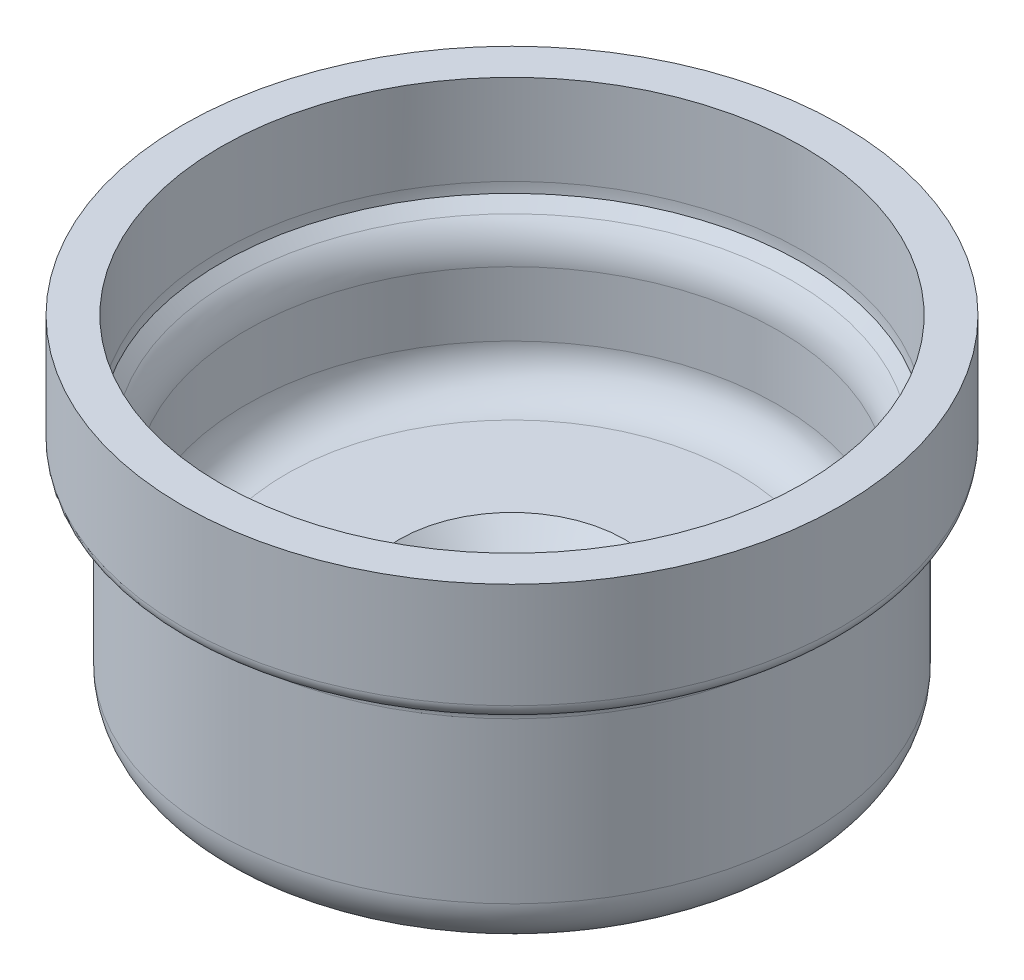
from build123d import *

# Parameters (mm, degrees)
SKETCH1_R           = 29.55
SKETCH1_R_2         = 26.55
BOSS_EXTRUDE1_DEPTH = 15
BOSS_EXTRUDE2_START = 10
SKETCH2_R           = 29.55
BOSS_EXTRUDE2_DEPTH = 10
CHAMFER1_SIZE       = 2.5
FILLET1_R           = 4
SKETCH4_R           = 32.9
SKETCH4_R_2         = 29.1
BOSS_EXTRUDE3_DEPTH = 10
BOSS_EXTRUDE4_START = 2
SKETCH5_R           = 32.9
SKETCH5_R_2         = 29.55
BOSS_EXTRUDE4_DEPTH = 2
FILLET3_R           = 2
FILLET6_R           = 5
FILLET7_R           = 5
FILLET8_R           = 1.5
SKETCH6_R           = 8.25
CUT_EXTRUDE1_DEPTH  = 7
CHAMFER4_SIZE       = 3
SKETCH7_R           = 4.1
CUT_EXTRUDE2_DEPTH  = 57.4696385
FILLET9_R           = 2
FILLET10_R          = 10


with BuildPart() as part:
    # Sketch1 → Boss-Extrude1 (new body)
    with BuildSketch(Plane(origin=(0, 0, 0), x_dir=(1, 0, 0), z_dir=(0, 1, 0))):
        with Locations(Location((0, 0, 0), (0, 0, 270))):
            Circle(SKETCH1_R)
        with Locations(Location((0, 0, 0), (0, 0, 270))):
            Circle(SKETCH1_R_2, mode=Mode.SUBTRACT)
    extrude(amount=BOSS_EXTRUDE1_DEPTH)

    # Sketch2 → Boss-Extrude2 (add)
    with BuildSketch(Plane.XZ.offset(BOSS_EXTRUDE2_START)):
        with Locations(Location((0, 0, 0), (0, 0, 270))):
            Circle(SKETCH2_R)
    extrude(amount=-BOSS_EXTRUDE2_DEPTH)

    # Chamfer1
    chamfer1_edges = [part.edges().sort_by_distance(p)[0] for p in [
        (0, 15, -26.55),
    ]]
    chamfer(chamfer1_edges, length=CHAMFER1_SIZE)

    # Fillet1
    fillet1_edges = [part.edges().sort_by_distance(p)[0] for p in [
        (0, 0, -26.55),
    ]]
    fillet(fillet1_edges, radius=FILLET1_R)

    # Sketch4 → Boss-Extrude3 (add)
    with BuildSketch(Plane(origin=(0, 15, 0), x_dir=(1, 0, 0), z_dir=(0, 1, 0))):
        with Locations(Location((0, 0, 0), (0, 0, 270))):
            Circle(SKETCH4_R)
        with Locations(Location((0, 0, 0), (0, 0, 270))):
            Circle(SKETCH4_R_2, mode=Mode.SUBTRACT)
    extrude(amount=BOSS_EXTRUDE3_DEPTH)

    # Sketch5 → Boss-Extrude4 (add)
    with BuildSketch(Plane.XZ.offset(-15).offset(BOSS_EXTRUDE4_START)):
        with Locations(Location((0, 0, 0), (0, 0, 270))):
            Circle(SKETCH5_R)
        with Locations(Location((0, 0, 0), (0, 0, 270))):
            Circle(SKETCH5_R_2, mode=Mode.SUBTRACT)
    extrude(amount=-BOSS_EXTRUDE4_DEPTH)

    # Fillet3
    fillet3_edges = [part.edges().sort_by_distance(p)[0] for p in [
        (0, 13, -29.55),
    ]]
    fillet(fillet3_edges, radius=FILLET3_R)

    # Fillet6
    fillet6_edges = [part.edges().sort_by_distance(p)[0] for p in [
        (0, 12.5, -26.55),
    ]]
    fillet(fillet6_edges, radius=FILLET6_R)

    # Fillet7
    fillet7_edges = [part.edges().sort_by_distance(p)[0] for p in [
        (0, -10, 29.55),
    ]]
    fillet(fillet7_edges, radius=FILLET7_R)

    # Fillet8
    fillet8_edges = [part.edges().sort_by_distance(p)[0] for p in [
        (0, 13, 32.9),
    ]]
    fillet(fillet8_edges, radius=FILLET8_R)

    # Sketch6 → Cut-Extrude1 (cut)
    with BuildSketch(Plane(origin=(0, 0, 0), x_dir=(1, 0, 0), z_dir=(0, 1, 0))):
        with Locations(Location((0, 0, 0), (0, 0, 270))):
            Circle(SKETCH6_R)
    extrude(amount=-CUT_EXTRUDE1_DEPTH, mode=Mode.SUBTRACT)

    # Chamfer4
    chamfer4_edges = [part.edges().sort_by_distance(p)[0] for p in [
        (0, 0, -8.25),
    ]]
    chamfer(chamfer4_edges, length=CHAMFER4_SIZE)

    # Sketch7 → Cut-Extrude2 (cut, through all)
    with BuildSketch(Plane(origin=(0, -7, 0), x_dir=(1, 0, 0), z_dir=(0, 1, 0))):
        with Locations(Location((0, 0, 0), (0, 0, 270))):
            Circle(SKETCH7_R)
    extrude(amount=-CUT_EXTRUDE2_DEPTH, mode=Mode.SUBTRACT)

    # Sketch8 → Cut-Revolve1 (revolve, cut)
    with BuildSketch(Plane.XY, mode=Mode.PRIVATE) as cut_revolve1_sk:
        with BuildLine():
            Line((22.55, -10), (12.55, -10))
            ThreePointArc((12.55, -10), (17.55, -5), (22.55, -10))
        make_face()
    revolve(cut_revolve1_sk.sketch.rotate(Axis((0, -10, 0), (0, 1, 0)), 90), axis=Axis((0, -10, 0), (0, 1, 0)), mode=Mode.SUBTRACT)

    # Fillet9
    fillet9_edges = [part.edges().sort_by_distance(p)[0] for p in [
        (0, -10, 22.55),
    ]]
    fillet(fillet9_edges, radius=FILLET9_R)

    # Fillet10
    # the kernel refuses this fillet: 10 mm, written as the material it adds along each edge
    with BuildSketch(Plane(origin=(0, 15, 0), x_dir=(0, 0, 1), z_dir=(-1, 0, 0))) as fillet10_piece_1:
        with BuildLine():
            CenterArc((19.1, 0.998749218), FILLET10_R, 354.268032035, 5.731967965)
            Line((29.05, 0), (29.1, 0))
            Line((29.1, 0), (29.1, 0.998749218))
        make_face()
    revolve(axis=Axis((0, 15, 0), (0, 1, 0)))


solid = part.part
